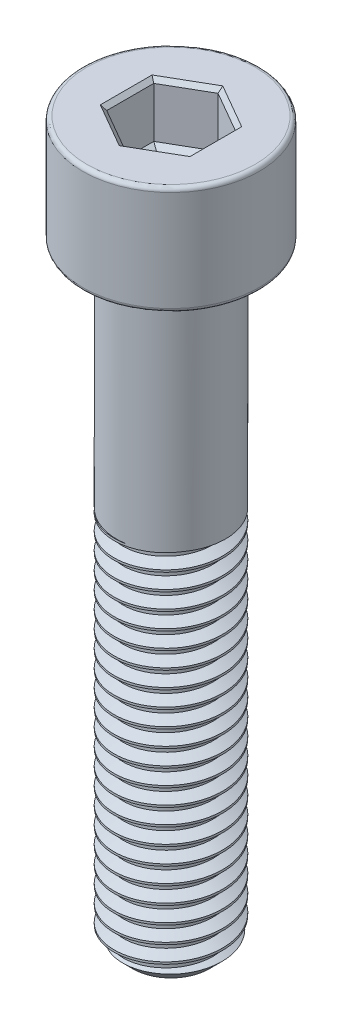
from build123d import *

# Parameters (mm, degrees)
SKETCH1_R           = 4
BOSS_EXTRUDE1_DEPTH = 28
THREAD1_PITCH       = 1.25
SKETCH2_R           = 4
BOSS_EXTRUDE2_DEPTH = 17
SKETCH5_R           = 6.5
BOSS_EXTRUDE3_DEPTH = 8
FILLET1_R           = 0.3
CUT_EXTRUDE1_DEPTH  = 4
CHAMFER1_SIZE       = 0.3
CUT_EXTRUDE2_DEPTH  = 0.4
CUT_EXTRUDE2_DRAFT  = -60


with BuildPart() as part:
    # Sketch1 → Boss-Extrude1 (new body)
    with BuildSketch(Plane(origin=(0, 0, 0), x_dir=(1, 0, 0), z_dir=(0, 1, 0))):
        with Locations(Location((0, 0, 0), (0, 0, 270))):
            Circle(SKETCH1_R)
    extrude(amount=BOSS_EXTRUDE1_DEPTH)

    # Thread1: the profile of Thread Profile1 profile screwed along a right-hand helix of 24 turns, 8 arcs to a turn; built about Z, then put on its axis
    thread1_z = Axis((0, 0, 0), (0, 0, 1))
    thread1_corners = [(4.0003, 0, -0.000173205), (4.0003, 0, 1.093923202), (3.323417656, 0, 0.703124998), (3.323417656, 0, 0.390624998)]
    with BuildLine(mode=Mode.PRIVATE) as thread1_profile:
        Line(thread1_corners[0], thread1_corners[1])
        Line(thread1_corners[1], thread1_corners[2])
        Line(thread1_corners[2], thread1_corners[3])
        Line(thread1_corners[3], thread1_corners[0])
    thread1_cap = Face(thread1_profile.wire())
    thread1_turn_angles = [0, 22.5, 45, 67.5, 90, 112.5, 135, 157.5, 180, 202.5, 225, 247.5, 270, 292.5, 315, 337.5, 360]
    thread1_turn_weights = [1, 0.9238795325112867, 1, 0.9238795325112867, 1, 0.9238795325112867, 1, 0.9238795325112867, 1, 0.9238795325112867, 1, 0.9238795325112867, 1, 0.9238795325112867, 1, 0.9238795325112867, 1]
    thread1_turn_rails = [Edge.make_bspline([Vector(p[0], p[1], 0).rotate(thread1_z, thread1_turn_angles[k]) / thread1_turn_weights[k] + Vector(0, 0, p[2] + THREAD1_PITCH * thread1_turn_angles[k] / 360) for k in range(17)], [0, 0, 0, 1, 1, 2, 2, 3, 3, 4, 4, 5, 5, 6, 6, 7, 7, 8, 8, 8], 2, thread1_turn_weights) for p in thread1_corners]
    thread1_turn_sides = [Face.make_surface_from_curves(thread1_turn_rails[p[0]], thread1_turn_rails[p[1]]) for p in [(0, 1), (1, 2), (2, 3), (3, 0)]]
    thread1 = Plane(origin=(0, 30, 0), x_dir=(-1, 0, 0), z_dir=(0, -1, 0)) * Solid(Shell([*[p.moved(Location((0, 0, THREAD1_PITCH * i))) for i in range(24) for p in thread1_turn_sides], thread1_cap, thread1_cap.rotate(thread1_z, 8640).moved(Location((0, 0, THREAD1_PITCH * 8640 / 360)))]))
    add(thread1, mode=Mode.SUBTRACT)

    # Sketch2 → Boss-Extrude2 (add)
    with BuildSketch(Plane(origin=(0, 28, 0), x_dir=(1, 0, 0), z_dir=(0, 1, 0))):
        with Locations(Location((0, 0, 0), (0, 0, 117.593571361))):
            Circle(SKETCH2_R)
    extrude(amount=BOSS_EXTRUDE2_DEPTH)

    # Sketch5 → Boss-Extrude3 (add)
    with BuildSketch(Plane(origin=(0, 45, 0), x_dir=(1, 0, 0), z_dir=(0, 1, 0))):
        with Locations(Location((0, 0, 0), (0, 0, 270))):
            Circle(SKETCH5_R)
    extrude(amount=BOSS_EXTRUDE3_DEPTH)

    # Sketch6 → Cut-Revolve1 (revolve, cut)
    with BuildSketch(Plane.XY, mode=Mode.PRIVATE) as cut_revolve1_sk:
        Polygon((4.01, 0), (4.01, 1.2), (2.81, 0), align=None)
    revolve(cut_revolve1_sk.sketch.rotate(Axis((0, 0, 0), (0, 1, 0)), 117.593571361), axis=Axis((0, 0, 0), (0, 1, 0)), mode=Mode.SUBTRACT)

    # Fillet1
    fillet1_edges = [part.edges().sort_by_distance(p)[0] for p in [
        (0, 45, -6.5),
        (0, 53, -6.5),
    ]]
    fillet(fillet1_edges, radius=FILLET1_R)

    # Sketch7 → Cut-Extrude1 (cut)
    with BuildSketch(Plane(origin=(0, 53, 0), x_dir=(1, 0, 0), z_dir=(0, 1, 0))):
        Polygon((0, 3.464101615), (-3, 1.732050808), (-3, -1.732050808), (0, -3.464101615), (3, -1.732050808), (3, 1.732050808), align=None)
    extrude(amount=-CUT_EXTRUDE1_DEPTH, mode=Mode.SUBTRACT)

    # Chamfer1
    chamfer1_edges = [part.edges().sort_by_distance(p)[0] for p in [
        (1.5, 53, -2.598076211),
        (-1.5, 53, -2.598076211),
        (-3, 53, 0),
        (-1.5, 53, 2.598076211),
        (1.5, 53, 2.598076211),
        (3, 53, 0),
    ]]
    chamfer(chamfer1_edges, length=CHAMFER1_SIZE)


with BuildPart() as cut_extrude2_tool:
    # Sketch8 → Cut-Extrude2 (with draft: the straight prism first)
    with BuildSketch(Plane(origin=(0, 49, 0), x_dir=(1, 0, 0), z_dir=(0, 1, 0))):
        Polygon((0, 3.464101615), (-3, 1.732050808), (-3, -1.732050808), (0, -3.464101615), (3, -1.732050808), (3, 1.732050808), align=None)
    extrude(amount=-CUT_EXTRUDE2_DEPTH)
    # Cut-Extrude2: the draft: its side faces are tilted about the plane it starts from
    cut_extrude2_sides = [cut_extrude2_tool.faces().sort_by_distance(p)[0] for p in [
        (-1.5, 48.8, -2.598076211),
        (-3, 48.8, 0),
        (-1.5, 48.8, 2.598076211),
        (1.5, 48.8, 2.598076211),
        (3, 48.8, 0),
        (1.5, 48.8, -2.598076211),
    ]]
    draft(cut_extrude2_sides, Plane(origin=(0, 49, 0), x_dir=(1, 0, 0), z_dir=(0, 1, 0)), CUT_EXTRUDE2_DRAFT)


with BuildPart() as part_1:
    add(part.part)

    # Cut-Extrude2: cut by cut_extrude2_tool
    add(cut_extrude2_tool.part, mode=Mode.SUBTRACT)


solid = part_1.part
